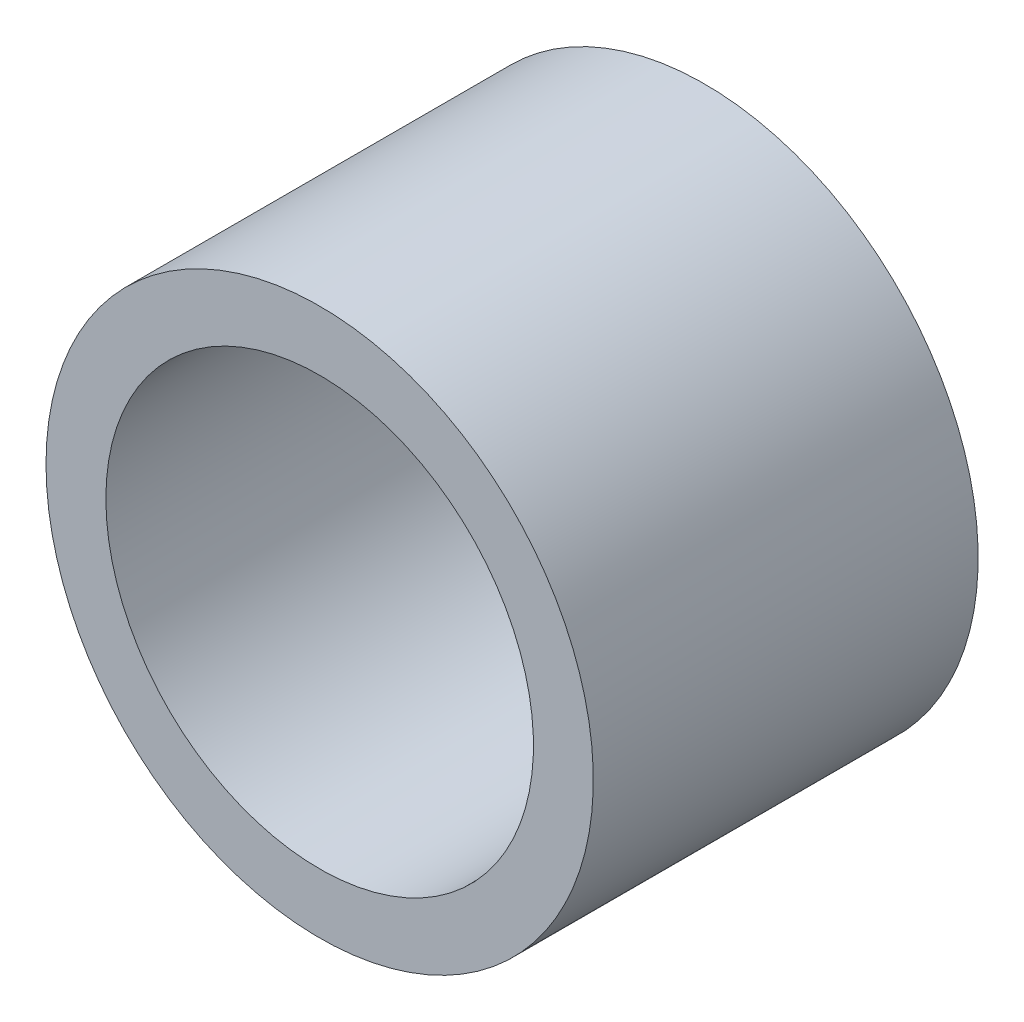
from build123d import *

# Parameters (mm, degrees)
SKETCH_1_R          = 16
EXTRUDE_1_DEPTH     = 22.5
SKETCH_2_R          = 15
CUT_EXTRUDE_3_DEPTH = 4
SKETCH_3_R          = 12.5
CUT_EXTRUDE_4_DEPTH = 30.227555491


with BuildPart() as part:
    # Эскиз1 → Вытянуть1 (new body)
    with BuildSketch(Plane.XY):
        Circle(SKETCH_1_R)
    extrude(amount=EXTRUDE_1_DEPTH)

    # Эскиз2 → Вытянуть3 (cut)
    with BuildSketch(Plane(origin=(0, 0, 0), x_dir=(-1, 0, 0), z_dir=(0, 0, -1))):
        Circle(SKETCH_2_R)
    extrude(amount=-CUT_EXTRUDE_3_DEPTH, mode=Mode.SUBTRACT)

    # Эскиз3 → Вытянуть4 (cut, through all)
    with BuildSketch(Plane(origin=(0, 0, 4), x_dir=(-1, 0, 0), z_dir=(0, 0, -1))):
        Circle(SKETCH_3_R)
    extrude(amount=-CUT_EXTRUDE_4_DEPTH, mode=Mode.SUBTRACT)


solid = part.part
